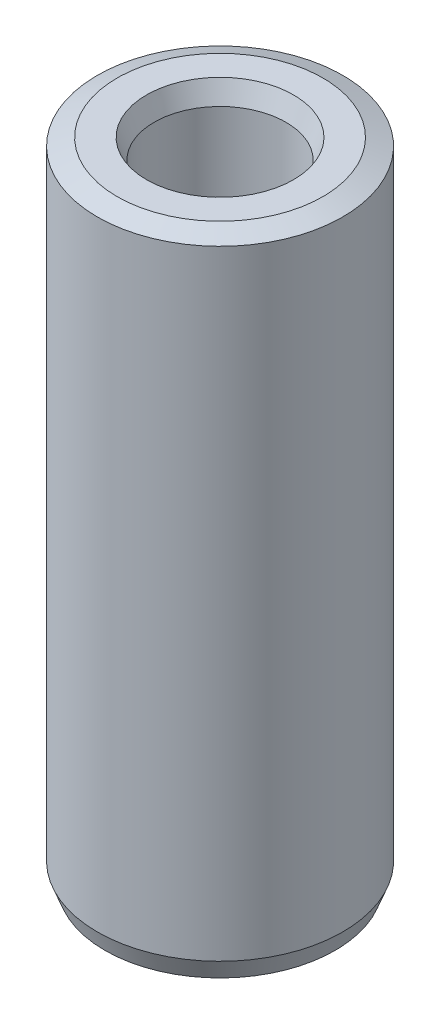
from build123d import *
from OCP.BRepFilletAPI import BRepFilletAPI_MakeChamfer

# Parameters (mm, degrees)
SKETCH1_R           = 50
BOSS_EXTRUDE1_DEPTH = 263.521187924
SKETCH2_R           = 26.83881297
CUT_EXTRUDE1_DEPTH  = 273.84320861
CHAMFER1_SIZE       = 3.11412363
CHAMFER1_SIZE2      = 8.089277319


with BuildPart() as part:
    # Sketch1 → Boss-Extrude1 (new body)
    with BuildSketch(Plane(origin=(0, 0, 0), x_dir=(1, 0, 0), z_dir=(0, 1, 0))):
        Circle(SKETCH1_R)
    extrude(amount=BOSS_EXTRUDE1_DEPTH)

    # Sketch2 → Cut-Extrude1 (cut, through all)
    with BuildSketch(Plane(origin=(0, 0, 0), x_dir=(1, 0, 0), z_dir=(0, 1, 0))):
        Circle(SKETCH2_R)
    extrude(amount=CUT_EXTRUDE1_DEPTH, mode=Mode.SUBTRACT)

    # Chamfer1: one chamfer whose edges measure the first distance from different faces: ONE call of the kernel's chamfer builder (chamfer() names one face for all edges)
    chamfer1_edges_1 = [part.edges().sort_by_distance(p)[0] for p in [
        (-26.83881297, 263.521187924, 0),
    ]]
    chamfer1_side_1 = [part.faces().sort_by_distance(p)[0] for p in [
        (-48.585786438, 263.521187924, 0),
    ]]
    chamfer1_edges_2 = [part.edges().sort_by_distance(p)[0] for p in [
        (-26.83881297, 0, 0),
    ]]
    chamfer1_side_2 = [part.faces().sort_by_distance(p)[0] for p in [
        (-26.83881297, 131.760593962, 0),
    ]]
    chamfer1_edges_3 = [part.edges().sort_by_distance(p)[0] for p in [
        (-50, 0, 0),
    ]]
    chamfer1_side_3 = [part.faces().sort_by_distance(p)[0] for p in [
        (-48.585786438, 0, 0),
    ]]
    chamfer1_edges_4 = [part.edges().sort_by_distance(p)[0] for p in [
        (-50, 263.521187924, 0),
    ]]
    chamfer1_side_4 = [part.faces().sort_by_distance(p)[0] for p in [
        (-50, 131.760593962, 0),
    ]]
    chamfer1 = BRepFilletAPI_MakeChamfer(part.part.solid().wrapped)
    for e in chamfer1_edges_1:
        chamfer1.Add(CHAMFER1_SIZE, CHAMFER1_SIZE2, e.wrapped, chamfer1_side_1[0].wrapped)  # the first distance lies on this face
    for e in chamfer1_edges_2:
        chamfer1.Add(CHAMFER1_SIZE, CHAMFER1_SIZE2, e.wrapped, chamfer1_side_2[0].wrapped)  # the first distance lies on this face
    for e in chamfer1_edges_3:
        chamfer1.Add(CHAMFER1_SIZE, CHAMFER1_SIZE2, e.wrapped, chamfer1_side_3[0].wrapped)  # the first distance lies on this face
    for e in chamfer1_edges_4:
        chamfer1.Add(CHAMFER1_SIZE, CHAMFER1_SIZE2, e.wrapped, chamfer1_side_4[0].wrapped)  # the first distance lies on this face
    add(Compound.cast(chamfer1.Shape()), mode=Mode.REPLACE)


solid = part.part
